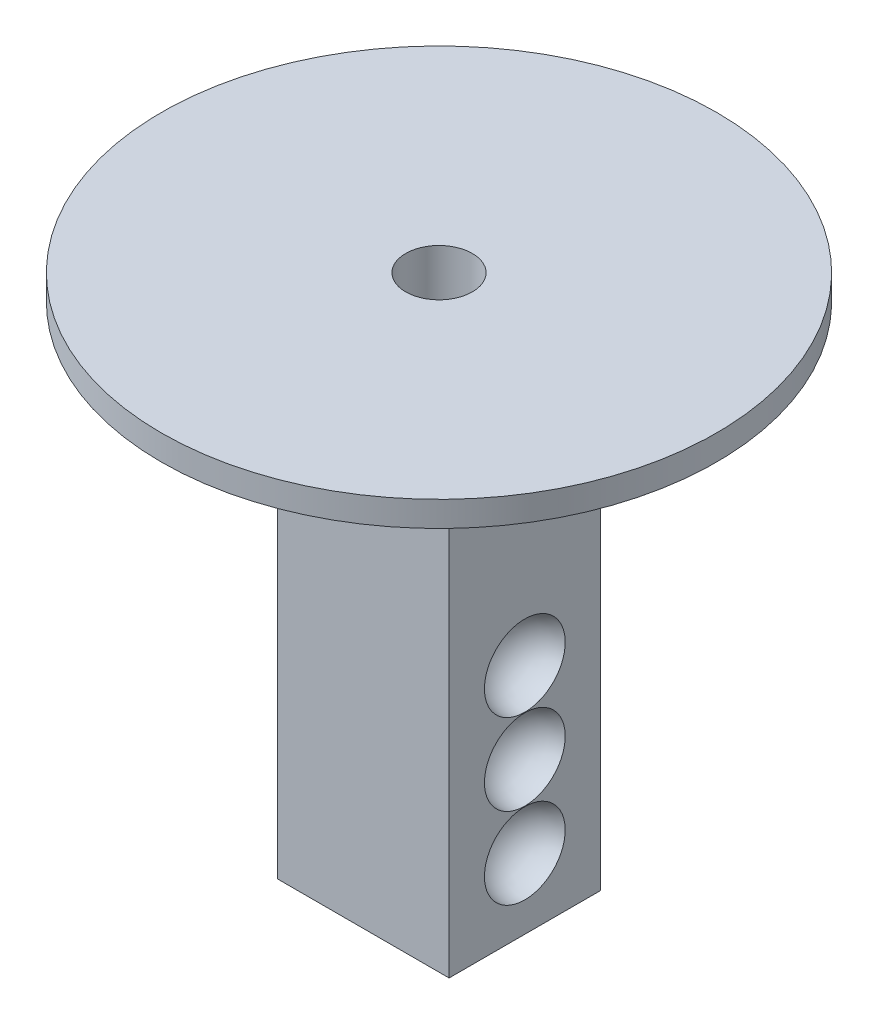
from build123d import *
from build123d.topology import SkipClean

# Parameters (mm, degrees)
SKETCH_5_W                 = 17
SKETCH_5_H                 = 100
EXTRUDE_1_DEPTH            = 15
PATTERN_LINEAR_1_COUNT     = 2
PATTERN_LINEAR_1_PITCH     = 16.1
PATTERN_LINEAR_1_COL_COUNT = 2
PATTERN_LINEAR_1_COL_PITCH = 16.1
SKETCH_9_W                 = 55
SKETCH_9_H                 = 5
CUT_EXTRUDE_1_DEPTH        = 109.050913925
CUT_EXTRUDE_1_DEPTH_BACK   = 109.050913925
SKETCH_12_R                = 6.6
SKETCH_15_R                = 8
CUT_EXTRUDE_4_DEPTH        = 109.050913925


with BuildPart() as part:
    # 草图5 → 凸台-拉伸1 (new, symmetric)
    with BuildSketch(Plane.XY):
        with Locations((-8.5, 20)):
            Rectangle(SKETCH_5_W, SKETCH_5_H)
    extrude_1 = extrude(amount=EXTRUDE_1_DEPTH, both=True)

    # 草图7 → 切除-旋转1 (revolve, cut)
    with BuildSketch(Plane.XY):
        with BuildLine():
            Line((-17, 8), (-17, -8))
            ThreePointArc((-17, -8), (-9, 0), (-17, 8))
        make_face()
    cut_revolve_1 = revolve(axis=Axis((-17, 8, 0), (0, -1, 0)), mode=Mode.SUBTRACT)

    # 阵列(线性)1: 切除-旋转1 ×2
    with Locations(*[(0, i * PATTERN_LINEAR_1_PITCH, 0) for i in range(1, PATTERN_LINEAR_1_COUNT)]):
        add(cut_revolve_1, mode=Mode.SUBTRACT)

    # 阵列(线性)1 col: 切除-旋转1 ×2
    with Locations(*[(0, -i * PATTERN_LINEAR_1_COL_PITCH, 0) for i in range(1, PATTERN_LINEAR_1_COL_COUNT)]):
        add(cut_revolve_1, mode=Mode.SUBTRACT)

    # 镜向2: 凸台-拉伸1 across plane
    add(extrude_1.mirror(Plane(origin=(0, 0, 0), x_dir=(0, 0, 1), z_dir=(1, 0, 0))))

    # 镜向3: 切除-旋转1 across plane
    with SkipClean():  # the faces are left unmerged after this step: merging them gives an invalid solid
        add(cut_revolve_1.mirror(Plane(origin=(0, 0, 0), x_dir=(0, 0, 1), z_dir=(1, 0, 0))), mode=Mode.SUBTRACT)

    # 镜向4 copy 1 sketch → 镜向4 copy 1 (revolve, cut)
    with SkipClean():  # the faces are left unmerged after this step: merging them gives an invalid solid
        with BuildSketch(Plane(origin=(0, 16.1, 0), x_dir=(-1, 0, 0), z_dir=(0, 0, 1))):
            with BuildLine():
                Line((-17, -8), (-17, 8))
                ThreePointArc((-17, 8), (-9, 0), (-17, -8))
            make_face()
        revolve(axis=Axis((17, 24.1, 0), (0, 1, 0)), mode=Mode.SUBTRACT)

    # 镜向4 copy 2 sketch → 镜向4 copy 2 (revolve, cut)
    with SkipClean():  # the faces are left unmerged after this step: merging them gives an invalid solid
        with BuildSketch(Plane(origin=(0, -16.1, 0), x_dir=(-1, 0, 0), z_dir=(0, 0, 1))):
            with BuildLine():
                Line((-17, -8), (-17, 8))
                ThreePointArc((-17, 8), (-9, 0), (-17, -8))
            make_face()
        revolve(axis=Axis((17, -8.1, 0), (0, 1, 0)), mode=Mode.SUBTRACT)

    # 镜向4 copy 3 sketch → 镜向4 copy 3 (revolve, cut)
    with SkipClean():  # the faces are left unmerged after this step: merging them gives an invalid solid
        with BuildSketch(Plane(origin=(0, 0, 0), x_dir=(-1, 0, 0), z_dir=(0, 0, 1))):
            with BuildLine():
                Line((-17, -8), (-17, 8))
                ThreePointArc((-17, 8), (-9, 0), (-17, -8))
            make_face()
        revolve(axis=Axis((17, 8, 0), (0, 1, 0)), mode=Mode.SUBTRACT)

    # 草图9 → 旋转1 (revolve)
    with SkipClean():  # the faces are left unmerged after this step: merging them gives an invalid solid
        with BuildSketch(Plane.XY):
            with Locations((27.5, 72.5)):
                Rectangle(SKETCH_9_W, SKETCH_9_H)
        revolve(axis=Axis((0, 70, 0), (0, 1, 0)))

    # 草图12 → 切除-拉伸1 (cut, two sides: drawn at the far end of the back side and taken through both)
    with SkipClean():  # the faces are left unmerged after this step: merging them gives an invalid solid
        with BuildSketch(Plane(origin=(0, 0, 0), x_dir=(1, 0, 0), z_dir=(0, 1, 0)).offset(-CUT_EXTRUDE_1_DEPTH_BACK)):
            Circle(SKETCH_12_R)
        extrude(amount=CUT_EXTRUDE_1_DEPTH + CUT_EXTRUDE_1_DEPTH_BACK, mode=Mode.SUBTRACT)

    # 草图15 → 切除-拉伸4 (cut, through all)
    with SkipClean():  # the faces are left unmerged after this step: merging them gives an invalid solid
        with BuildSketch(Plane(origin=(0, 0, 0), x_dir=(1, 0, 0), z_dir=(0, 1, 0))):
            Circle(SKETCH_15_R)
        extrude(amount=-CUT_EXTRUDE_4_DEPTH, mode=Mode.SUBTRACT)


solid = part.part
